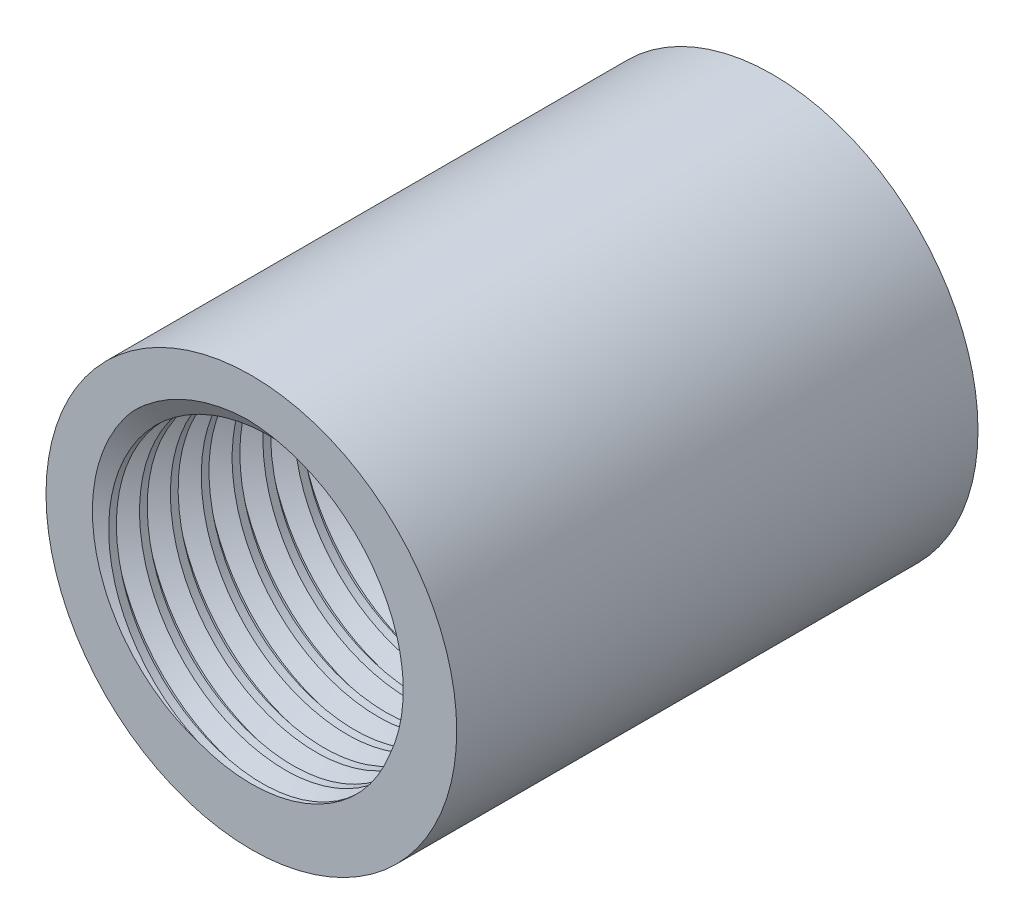
from build123d import *

# Parameters (mm, degrees)
SZKIC1_R                    = 13
SZKIC1_R_2                  = 9.4
DODANIE_WYCI_GNI_CIE1_DEPTH = 33
GWINT1_PITCH                = 1.953846154


with BuildPart() as part:
    # Szkic1 → Dodanie-wyciągnięcie1 (new body)
    with BuildSketch(Plane.XY):
        Circle(SZKIC1_R)
        Circle(SZKIC1_R_2, mode=Mode.SUBTRACT)
    extrude(amount=DODANIE_WYCI_GNI_CIE1_DEPTH)

    # Gwint1: the profile of Profil gwintu1 profile screwed along a right-hand helix of 19.448819 turns, 10 arcs to a turn; built about Z, then put on its axis
    gwint1_z = Axis((0, 0, 0), (0, 0, 1))
    gwint1_corners = [(9.3997, 0, -0.000173205), (10.457550248, 0, 0.61057692), (10.457550248, 0, 0.85480769), (9.3997, 0, 1.465557815)]
    with BuildLine(mode=Mode.PRIVATE) as gwint1_profile:
        Line(gwint1_corners[0], gwint1_corners[1])
        Line(gwint1_corners[1], gwint1_corners[2])
        Line(gwint1_corners[2], gwint1_corners[3])
        Line(gwint1_corners[3], gwint1_corners[0])
    gwint1_cap = Face(gwint1_profile.wire())
    gwint1_turn_angles = [0, 18, 36, 54, 72, 90, 108, 126, 144, 162, 180, 198, 216, 234, 252, 270, 288, 306, 324, 342, 360]
    gwint1_turn_weights = [1, 0.9510565162951535, 1, 0.9510565162951535, 1, 0.9510565162951535, 1, 0.9510565162951535, 1, 0.9510565162951535, 1, 0.9510565162951535, 1, 0.9510565162951535, 1, 0.9510565162951535, 1, 0.9510565162951535, 1, 0.9510565162951535, 1]
    gwint1_turn_rails = [Edge.make_bspline([Vector(p[0], p[1], 0).rotate(gwint1_z, gwint1_turn_angles[k]) / gwint1_turn_weights[k] + Vector(0, 0, p[2] + GWINT1_PITCH * gwint1_turn_angles[k] / 360) for k in range(21)], [0, 0, 0, 1, 1, 2, 2, 3, 3, 4, 4, 5, 5, 6, 6, 7, 7, 8, 8, 9, 9, 10, 10, 10], 2, gwint1_turn_weights) for p in gwint1_corners]
    gwint1_turn_sides = [Face.make_surface_from_curves(gwint1_turn_rails[p[0]], gwint1_turn_rails[p[1]]) for p in [(0, 1), (1, 2), (2, 3), (3, 0)]]
    gwint1_last_angles = [6840, 6858, 6876, 6894, 6912, 6930, 6948, 6966, 6984, 6992.787401575, 7001.57480315]
    gwint1_last_weights = [1, 0.9510565162951535, 1, 0.9510565162951535, 1, 0.9510565162951535, 1, 0.9510565162951535, 1, 0.9882619966940323, 1]
    gwint1_last_rails = [Edge.make_bspline([Vector(p[0], p[1], 0).rotate(gwint1_z, gwint1_last_angles[k]) / gwint1_last_weights[k] + Vector(0, 0, p[2] + GWINT1_PITCH * gwint1_last_angles[k] / 360) for k in range(11)], [0, 0, 0, 1, 1, 2, 2, 3, 3, 4, 4, 5, 5, 5], 2, gwint1_last_weights) for p in gwint1_corners]
    gwint1_last_sides = [Face.make_surface_from_curves(gwint1_last_rails[p[0]], gwint1_last_rails[p[1]]) for p in [(0, 1), (1, 2), (2, 3), (3, 0)]]
    gwint1 = Plane(origin=(0, 0, 38), x_dir=(-1, 0, 0), z_dir=(0, 0, -1)) * Solid(Shell([*[p.moved(Location((0, 0, GWINT1_PITCH * i))) for i in range(19) for p in gwint1_turn_sides], *gwint1_last_sides, gwint1_cap, gwint1_cap.rotate(gwint1_z, 7001.57480315).moved(Location((0, 0, GWINT1_PITCH * 7001.57480315 / 360)))]))
    add(gwint1, mode=Mode.SUBTRACT)


solid = part.part
